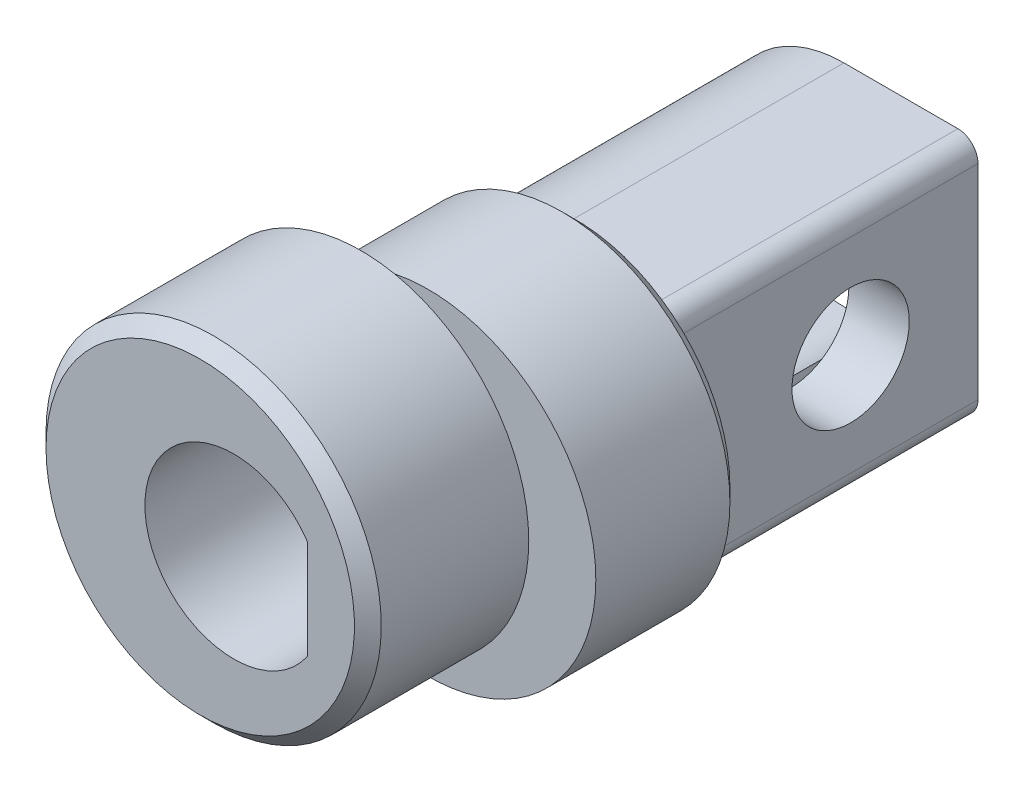
from build123d import *

# Parameters (mm, degrees)
BOSS_EXTRUDE4_DEPTH      = 4.2
BOSS_EXTRUDE4_DEPTH_BACK = 0.2
SKETCH10_R               = 5
BOSS_EXTRUDE5_DEPTH      = 9
SKETCH16_R               = 5
BOSS_EXTRUDE6_DEPTH      = 4.8
CUT_EXTRUDE2_DEPTH       = 20.805049861
HOLEWZD2_D               = 3.5
HOLEWZD2_DEPTH           = 1.8
CHAMFER2_SIZE            = 0.4


with BuildPart() as part:
    # Sketch10 → Boss-Extrude4 (new, two sides: drawn at the far end of the back side and taken through both)
    with BuildSketch(Plane.XY.offset(0.4).offset(-BOSS_EXTRUDE4_DEPTH_BACK)):
        with Locations((1, 0)):
            Circle(SKETCH10_R)
    extrude(amount=BOSS_EXTRUDE4_DEPTH + BOSS_EXTRUDE4_DEPTH_BACK)

    # Sketch11 → Boss-Extrude5 (add)
    with BuildSketch(Plane(origin=(0, 0, 0.2), x_dir=(-1, 0, 0), z_dir=(0, 0, -1))):
        with BuildLine():
            Line((-4, -3.05), (-4, 3.05))
            ThreePointArc((-4, 3.05), (-3.824264069, 3.474264069), (-3.4, 3.65))
            Line((-3.4, 3.65), (0, 3.65))
            ThreePointArc((0, 3.65), (3.65, 0), (0, -3.65))
            Line((0, -3.65), (-3.4, -3.65))
            ThreePointArc((-3.4, -3.65), (-3.824264069, -3.474264069), (-4, -3.05))
        make_face()
    extrude(amount=BOSS_EXTRUDE5_DEPTH)

    # Sketch16 → Boss-Extrude6 (add)
    with BuildSketch(Plane(origin=(0, 0, 4.6), x_dir=(-1, 0, 0), z_dir=(0, 0, -1))):
        with Locations((1, 0)):
            Circle(SKETCH16_R)
    extrude(amount=-BOSS_EXTRUDE6_DEPTH)

    # Sketch17 → Cut-Extrude2 (cut, through all)
    with BuildSketch(Plane.XY.offset(9.4)):
        with BuildLine():
            Line((2.2, -1.47732867), (2.2, 1.47732867))
            ThreePointArc((2.2, 1.47732867), (-2.65, 0), (2.2, -1.47732867))
        make_face()
    extrude(amount=-CUT_EXTRUDE2_DEPTH, mode=Mode.SUBTRACT)

    # HoleWzd2
    with Locations(Plane(origin=(4, 0, 0), x_dir=(0, 0, -1), z_dir=(1, 0, 0))):
        with Locations((5, 0)):
            Hole(HOLEWZD2_D / 2, depth=HOLEWZD2_DEPTH)

    # Chamfer2
    # the kernel refuses this chamfer: 0.4 mm, written as the material it takes off along each edge
    with BuildSketch(Plane(origin=(-1, 0, 9.4), x_dir=(-1, 0, 0), z_dir=(0, -1, 0))) as chamfer2_piece_1:
        Polygon((5, CHAMFER2_SIZE), (5 - CHAMFER2_SIZE, 0), (5, 0), align=None)
    revolve(axis=Axis((-1, 0, 9.4), (0, 0, -1)), mode=Mode.SUBTRACT)
    with BuildSketch(Plane(origin=(1, 0, 0.2), x_dir=(1, 0, 0), z_dir=(0, -1, 0))) as chamfer2_piece_2_section:
        Polygon((5, CHAMFER2_SIZE), (5 - CHAMFER2_SIZE, 0), (5, 0), align=None)
    chamfer2_piece_2 = revolve(axis=Axis((1, 0, 0.2), (0, 0, 1)), mode=Mode.PRIVATE)
    chamfer2_piece_2 = chamfer2_piece_2 - Plane(origin=(0, 0, 0.390166904), x_dir=(0, 1, 0), z_dir=(0, 0, 1)) * Cylinder(3.65, 20, mode=Mode.PRIVATE)
    add(chamfer2_piece_2, mode=Mode.SUBTRACT)


solid = part.part
